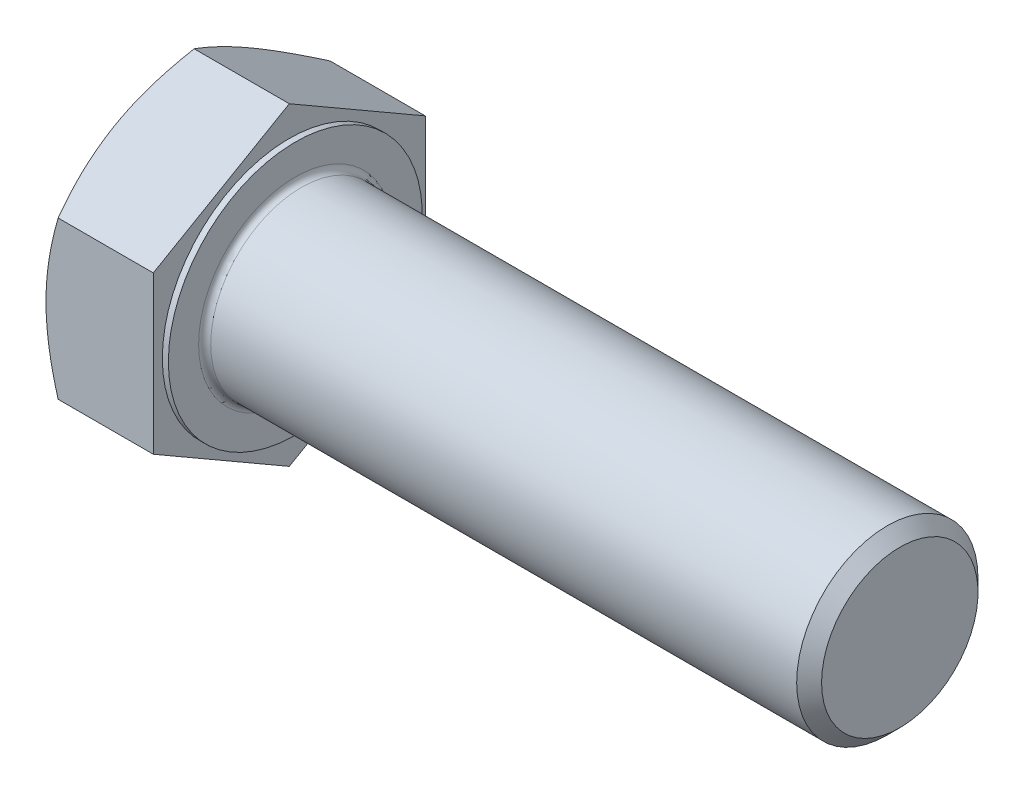
from build123d import *

# Parameters (mm, degrees)
BASEHEAD_DEPTH   = 15
BEARINGFACESKE_W = 0.8
BEARINGFACESKE_H = 3.979609691
FILLET_2_R       = 0.8


with BuildPart() as part:
    # BaseHeadSke → BaseHead (new body)
    with BuildSketch(Plane(origin=(0, 0, 0), x_dir=(0, 0, -1), z_dir=(1, 0, 0))):
        Polygon((18, 10.392304845), (0, 20.784609691), (-18, 10.392304845), (-18, -10.392304845), (0, -20.784609691), (18, -10.392304845), align=None)
    extrude(amount=BASEHEAD_DEPTH)

    # BodySke → BaseBody (revolve)
    with BuildSketch(Plane.XY):
        Polygon((0, 0), (95, 0), (95, 10.352), (93.352, 12), (0, 12), align=None)
    revolve(axis=Axis((0, 0, 0), (1, 0, 0)))

    # HeadChamferSke → HeadChamfer (revolve, cut)
    with BuildSketch(Plane.XY):
        Polygon((1.607695155, 20.784609691), (0, 20.784609691), (0, 18), align=None)
    revolve(axis=Axis((0, 0, 0), (1, 0, 0)), mode=Mode.SUBTRACT)

    # BearingFaceSke → BearingFace (revolve, cut)
    with BuildSketch(Plane.XY):
        with Locations((14.6, 18.794804845)):
            Rectangle(BEARINGFACESKE_W, BEARINGFACESKE_H)
    revolve(axis=Axis((0, 0, 0), (1, 0, 0)), mode=Mode.SUBTRACT)

    # Fillet 2
    fillet_2_edges = [part.edges().sort_by_distance(p)[0] for p in [
        (15, -12, 0),
    ]]
    fillet(fillet_2_edges, radius=FILLET_2_R)


solid = part.part
